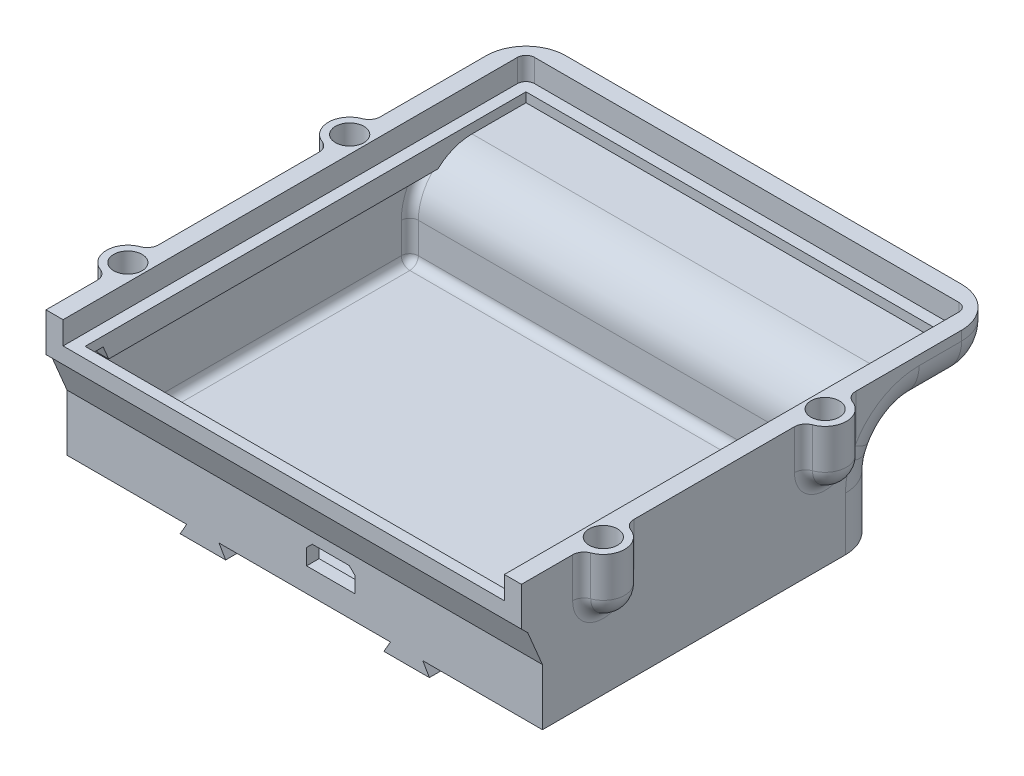
from build123d import *

# Parameters (mm, degrees)
SKETCH1_W            = 132
SKETCH1_H            = 85.5
SKETCH1_W_2          = 126
SKETCH1_H_2          = 79.5
BOSS_EXTRUDE1_DEPTH  = 21
SKETCH2_W            = 132
SKETCH2_H            = 85.5
BOSS_EXTRUDE2_DEPTH  = 3
SKETCH3_W            = 126
SKETCH3_H            = 3
CUT_EXTRUDE1_DEPTH   = 4
BOSS_EXTRUDE3_DEPTH  = 4
SKETCH6_W            = 12
SKETCH6_H            = 7.5
CUT_EXTRUDE2_DEPTH   = 3
BOSS_EXTRUDE4_DEPTH  = 85.5
SKETCH10_R           = 2.5
CUT_EXTRUDE3_DEPTH   = 7
SKETCH11_R           = 3.75
SKETCH11_R_2         = 2.5
BOSS_EXTRUDE5_DEPTH  = 7
REVOLVE2_ANGLE       = 90
SKETCH14_W           = 126
SKETCH14_H           = 82.5
CUT_EXTRUDE4_DEPTH   = 4
CUT_EXTRUDE5_REACH   = 88.597
SKETCH17_W           = 54.009013967
SKETCH17_H           = 11.661309321
REVOLVE3_ANGLE       = 90
FILLET1_R            = 2
SKETCH20_W           = 12
SKETCH20_H           = 7.5
BOSS_EXTRUDE8_DEPTH  = 2
SKETCH21_W           = 12
SKETCH21_H           = 7.5
CUT_EXTRUDE6_DEPTH   = 2
SKETCH22_W           = 66.226756427
SKETCH22_H           = 42.382951543
CUT_EXTRUDE7_DEPTH   = 90
SKETCH23_W           = 42.542497138
SKETCH23_H           = 32.518915608
CUT_EXTRUDE8_DEPTH   = 90
BOSS_EXTRUDE11_REACH = 69.779
SKETCH28_W           = 3
SKETCH28_H           = 7.5
SKETCH24_W           = 77.790944938
SKETCH24_H           = 2.5
BOSS_EXTRUDE9_DEPTH  = 4
SKETCH26_W           = 73.6
SKETCH26_H           = 4
BOSS_EXTRUDE10_DEPTH = 1
SKETCH27_W           = 8.505375435
SKETCH27_H           = 3.8
CUT_EXTRUDE9_DEPTH   = 3
CHAMFER1_SIZE        = 1
SKETCH31_W           = 77.6
SKETCH31_H           = 13
BOSS_EXTRUDE13_DEPTH = 6
CUT_EXTRUDE10_DEPTH  = 6.8
CHAMFER3_SIZE        = 4
SKETCH32_W           = 77.6
SKETCH32_H           = 75.5
CUT_EXTRUDE11_DEPTH  = 0.5
CUT_EXTRUDE12_REACH  = 102.145
SKETCH33_W           = 3.1
SKETCH33_H           = 11.91996344
CUT_EXTRUDE13_REACH  = 102.145
BOSS_EXTRUDE15_DEPTH = 83.6
FILLET2_R            = 7
BOSS_EXTRUDE16_DEPTH = 3
FILLET5_R            = 7
CUT_EXTRUDE14_START  = -87.35
CUT_EXTRUDE14_DEPTH  = 91.1
SKETCH39_W           = 83.6
SKETCH39_H           = 5.232590181
BOSS_EXTRUDE17_DEPTH = 2
SKETCH40_W           = 77.6
SKETCH40_H           = 1.874834467
BOSS_EXTRUDE18_DEPTH = 2.5
CUT_EXTRUDE15_REACH  = 99.54
FILLET3_R            = 1.5
BOSS_EXTRUDE28_DEPTH = 1.5
BOSS_EXTRUDE29_DEPTH = 83.6


with BuildPart() as part:
    # Sketch1 → Boss-Extrude1 (new body)
    with BuildSketch(Plane(origin=(0, 0, 0), x_dir=(1, 0, 0), z_dir=(0, 1, 0))):
        with Locations((0, 1.5)):
            Rectangle(SKETCH1_W, SKETCH1_H)
        with Locations((0, 1.5)):
            Rectangle(SKETCH1_W_2, SKETCH1_H_2, mode=Mode.SUBTRACT)
    extrude(amount=BOSS_EXTRUDE1_DEPTH)

    # Sketch2 → Boss-Extrude2 (add)
    with BuildSketch(Plane.XZ):
        with Locations((0, -1.5)):
            Rectangle(SKETCH2_W, SKETCH2_H)
    extrude(amount=BOSS_EXTRUDE2_DEPTH)

    # Sketch3 → Cut-Extrude1 (cut)
    with BuildSketch(Plane(origin=(0, 21, 0), x_dir=(1, 0, 0), z_dir=(0, 1, 0))):
        with Locations((0, -39.75)):
            Rectangle(SKETCH3_W, SKETCH3_H)
    extrude(amount=-CUT_EXTRUDE1_DEPTH, mode=Mode.SUBTRACT)

    # Sketch4 → Boss-Extrude3 (add)
    with BuildSketch(Plane(origin=(0, 17, 0), x_dir=(1, 0, 0), z_dir=(0, 1, 0))):
        Polygon((-61, 39.25), (-61, -38.25), (-63, -38.25), (-63, 41.25), (63, 41.25), (63, -38.25), (61, -38.25), (61, 39.25), align=None)
    extrude(amount=-BOSS_EXTRUDE3_DEPTH)

    # Sketch6 → Cut-Extrude2 (cut)
    with BuildSketch(Plane.XY.offset(41.25)):
        with Locations((-19.5, 7.5)):
            Rectangle(SKETCH6_W, SKETCH6_H)
        with Locations((32.5, 7.5)):
            Rectangle(SKETCH6_W, SKETCH6_H)
    extrude(amount=-CUT_EXTRUDE2_DEPTH, mode=Mode.SUBTRACT)

    # Sketch7 → Boss-Extrude4 (add)
    with BuildSketch(Plane.XY.offset(41.25)):
        Polygon((-46.113248654, -5), (-38.113248654, -5), (-39.267949192, -3), (-44.958548116, -3), align=None)
        Polygon((39.267949192, -3), (44.958548116, -3), (46.113248654, -5), (38.113248654, -5), align=None)
    extrude(amount=-BOSS_EXTRUDE4_DEPTH)

    # Sketch10 → Cut-Extrude3 (cut)
    with BuildSketch(Plane(origin=(0, 21, 0), x_dir=(1, 0, 0), z_dir=(0, 1, 0))):
        with Locations((-66, 13.25)):
            Circle(SKETCH10_R)
        with Locations((-66, -25.75)):
            Circle(SKETCH10_R)
        with Locations((66, -25.75)):
            Circle(SKETCH10_R)
    extrude(amount=-CUT_EXTRUDE3_DEPTH, mode=Mode.SUBTRACT)

    # Sketch11 → Boss-Extrude5 (add)
    # profile 1 of 3: a face of its own
    with BuildSketch(Plane(origin=(0, 21, 0), x_dir=(1, 0, 0), z_dir=(0, 1, 0))):
        with Locations((-66, 13.25)):
            Circle(SKETCH11_R)
        with Locations(Location((-66, 13.25, 0), (0, 0, 270))):
            Circle(SKETCH11_R_2, mode=Mode.SUBTRACT)
    # profile 2 of 3: a face of its own
    with BuildSketch(Plane(origin=(0, 21, 0), x_dir=(1, 0, 0), z_dir=(0, 1, 0))):
        with Locations((-66, -25.75)):
            Circle(SKETCH11_R)
        with Locations(Location((-66, -25.75, 0), (0, 0, 90))):
            Circle(SKETCH11_R_2, mode=Mode.SUBTRACT)
    # profile 3 of 3: a face of its own
    with BuildSketch(Plane(origin=(0, 21, 0), x_dir=(1, 0, 0), z_dir=(0, 1, 0))):
        with Locations((66, -25.75)):
            Circle(SKETCH11_R)
        with Locations(Location((66, -25.75, 0), (0, 0, 270))):
            Circle(SKETCH11_R_2, mode=Mode.SUBTRACT)
    extrude(amount=-BOSS_EXTRUDE5_DEPTH)

    # Sketch13 → Revolve2 (revolve)
    with BuildSketch(Plane.XZ.offset(-14)):
        with BuildLine():
            Line((-66, -17), (-66, -10.75))
            Line((-66, -10.75), (-66, -9.5))
            ThreePointArc((-66, -9.5), (-69.75, -13.25), (-66, -17))
        make_face()
        with BuildLine():
            Line((-66, 22), (-66, 28.25))
            Line((-66, 28.25), (-66, 29.5))
            ThreePointArc((-66, 29.5), (-69.75, 25.75), (-66, 22))
        make_face()
    revolve(axis=Axis((-66, 14, 22), (0, 0, 1)), revolution_arc=REVOLVE2_ANGLE)

    # Sketch14 → Cut-Extrude4 (cut)
    with BuildSketch(Plane(origin=(0, 21, 0), x_dir=(1, 0, 0), z_dir=(0, 1, 0))):
        Rectangle(SKETCH14_W, SKETCH14_H)
    extrude(amount=-CUT_EXTRUDE4_DEPTH, mode=Mode.SUBTRACT)

    # Cut-Extrude5: up to this face of the body (flat: up to its plane)
    cut_extrude5_end = Plane(part.part.faces().sort_by_distance((42.113248654, -5, -1.5))[0])
    # Sketch17 → Cut-Extrude5 (cut, up to the picked face)
    with BuildSketch(Plane(origin=(0, 21, 0), x_dir=(1, 0, 0), z_dir=(0, 1, 0)), mode=Mode.PRIVATE) as cut_extrude5_sk1:
        with Locations((41.004506984, 40.580654661)):
            Rectangle(SKETCH17_W, SKETCH17_H)
    cut_extrude5_tool1 = split(extrude(cut_extrude5_sk1.sketch, amount=-CUT_EXTRUDE5_REACH, mode=Mode.PRIVATE), bisect_by=cut_extrude5_end, keep=Keep.BOTH, mode=Mode.PRIVATE)
    add(cut_extrude5_tool1.solids().sort_by(Axis((41.004507, 21, -40.580655), (0, -1, 0)))[0], mode=Mode.SUBTRACT)

    # Sketch19 → Revolve3 (revolve)
    with BuildSketch(Plane.XZ.offset(-14)):
        with BuildLine():
            Line((66, 28.25), (66, 22))
            ThreePointArc((66, 22), (69.75, 25.75), (66, 29.5))
            Line((66, 29.5), (66, 28.25))
        make_face()
    revolve(axis=Axis((66, 14, 28.25), (0, 0, -1)), revolution_arc=REVOLVE3_ANGLE)

    # Fillet1
    fillet1_edges = [part.edges().sort_by_distance(p)[0] for p in [
        (-66, 17.5, -17),
        (-66, 17.5, -9.5),
        (-66, 17.5, 22),
        (-66, 17.5, 29.5),
        (66, 17.5, 29.5),
        (66, 17.5, 22),
        (-66, 10.25, 25.75),
        (-66, 10.25, -13.25),
        (66, 10.25, 25.75),
    ]]
    fillet(fillet1_edges, radius=FILLET1_R)

    # Sketch20 → Boss-Extrude8 (add)
    with BuildSketch(Plane.XY.offset(41.25)):
        Polygon((66, 21), (63, 21), (63, 17), (-63, 17), (-63, 21), (-66, 21), (-66, -3), (-44.958548116, -3), (-46.113248654, -5), (-38.113248654, -5), (-39.267949192, -3), (39.267949192, -3), (38.113248654, -5), (46.113248654, -5), (44.958548116, -3), (66, -3), align=None)
        with Locations((-19.5, 7.5)):
            Rectangle(SKETCH20_W, SKETCH20_H, mode=Mode.SUBTRACT)
        with Locations((32.5, 7.5)):
            Rectangle(SKETCH20_W, SKETCH20_H, mode=Mode.SUBTRACT)
    extrude(amount=BOSS_EXTRUDE8_DEPTH)

    # Sketch21 → Cut-Extrude6 (cut)
    with BuildSketch(Plane(origin=(0, 0, 38.25), x_dir=(-1, 0, 0), z_dir=(0, 0, -1))):
        Polygon((61, 13), (61, 17), (-61, 17), (-61, 13), (-63, 13), (-63, 0), (63, 0), (63, 13), align=None)
        with Locations((-32.5, 7.5)):
            Rectangle(SKETCH21_W, SKETCH21_H, mode=Mode.SUBTRACT)
        with Locations((19.5, 7.5)):
            Rectangle(SKETCH21_W, SKETCH21_H, mode=Mode.SUBTRACT)
    extrude(amount=-CUT_EXTRUDE6_DEPTH, mode=Mode.SUBTRACT)

    # Sketch22 → Cut-Extrude7 (cut)
    with BuildSketch(Plane(origin=(0, 0, -34.75), x_dir=(-1, 0, 0), z_dir=(0, 0, -1))):
        with Locations((-47.113378213, 8.416458625)):
            Rectangle(SKETCH22_W, SKETCH22_H)
    extrude(amount=-CUT_EXTRUDE7_DEPTH, mode=Mode.SUBTRACT)

    # Sketch23 → Cut-Extrude8 (cut)
    with BuildSketch(Plane.XY.offset(43.25)):
        with Locations((-2.928751431, 9.569248977)):
            Rectangle(SKETCH23_W, SKETCH23_H)
    extrude(amount=-CUT_EXTRUDE8_DEPTH, mode=Mode.SUBTRACT)

    # Mirror1: part across plane


with BuildPart() as part_1:
    add(part.part)
    add(part.part.mirror(Plane(origin=(-24.2, 25.828706781, -46.75), x_dir=(0, 0, 1), z_dir=(-1, 0, 0))))

    # Sketch28 → Boss-Extrude11 (add, up to next)
    with BuildSketch(Plane(origin=(-25.5, 0, 0), x_dir=(0, 0, -1), z_dir=(1, 0, 0)), mode=Mode.PRIVATE) as boss_extrude11_sk1:
        with Locations((-41.75, 7.5)):
            Rectangle(SKETCH28_W, SKETCH28_H)
    boss_extrude11_tool1 = extrude(boss_extrude11_sk1.sketch, amount=BOSS_EXTRUDE11_REACH, mode=Mode.PRIVATE) - part_1.part
    add(boss_extrude11_tool1.solids().sort_by_distance((-25.5, 7.5, 41.75))[0])

    # Sketch24 → Boss-Extrude9 (add)
    with BuildSketch(Plane(origin=(0, 17, 0), x_dir=(1, 0, 0), z_dir=(0, 1, 0))):
        with Locations((-24.295472469, -42)):
            Rectangle(SKETCH24_W, SKETCH24_H)
    extrude(amount=BOSS_EXTRUDE9_DEPTH)

    # Sketch26 → Boss-Extrude10 (add)
    with BuildSketch(Plane(origin=(0, 0, 40.25), x_dir=(-1, 0, 0), z_dir=(0, 0, -1))):
        with Locations((24.2, 15)):
            Rectangle(SKETCH26_W, SKETCH26_H)
    extrude(amount=BOSS_EXTRUDE10_DEPTH)

    # Sketch27 → Cut-Extrude9 (cut)
    with BuildSketch(Plane.XY.offset(43.25)):
        with Locations((-19.62505423, 3.12)):
            Rectangle(SKETCH27_W, SKETCH27_H)
    extrude(amount=-CUT_EXTRUDE9_DEPTH, mode=Mode.SUBTRACT)

    # Chamfer1
    chamfer1_edges = [part_1.edges().sort_by_distance(p)[0] for p in [
        (-23.877741947, 5.02, 41.75),
        (-15.372366512, 5.02, 41.75),
    ]]
    chamfer(chamfer1_edges, length=CHAMFER1_SIZE)

    # Sketch31 → Boss-Extrude13 (add)
    with BuildSketch(Plane(origin=(0, 0, 40.25), x_dir=(-1, 0, 0), z_dir=(0, 0, -1))):
        with Locations((24.2, 6.5)):
            Rectangle(SKETCH31_W, SKETCH31_H)
        Polygon((15.372366512, 1.22), (15.372366512, 4.02), (16.372366512, 5.02), (22.877741947, 5.02), (23.877741947, 4.02), (23.877741947, 1.22), align=None, mode=Mode.SUBTRACT)
    extrude(amount=BOSS_EXTRUDE13_DEPTH)

    # Sketch29 → Cut-Extrude10 (cut)
    with BuildSketch(Plane.XY.offset(43.25)):
        Polygon((-66, 10), (17.6, 10), (17.6, -3), (-3.441451884, -3), (-2.286751346, -5), (-10.286751346, -5), (-9.132050808, -3), (-39.267949192, -3), (-38.113248654, -5), (-46.113248654, -5), (-44.958548116, -3), (-66, -3), align=None)
    extrude(amount=-CUT_EXTRUDE10_DEPTH, mode=Mode.SUBTRACT)

    # Chamfer3
    chamfer3_edges = [part_1.edges().sort_by_distance(p)[0] for p in [
        (-24.2, 10, 36.45),
    ]]
    chamfer(chamfer3_edges, length=CHAMFER3_SIZE)

    # Sketch32 → Cut-Extrude11 (cut)
    with BuildSketch(Plane(origin=(0, 0, 0), x_dir=(1, 0, 0), z_dir=(0, 1, 0))):
        with Locations((-24.2, 3.5)):
            Rectangle(SKETCH32_W, SKETCH32_H)
    extrude(amount=-CUT_EXTRUDE11_DEPTH, mode=Mode.SUBTRACT)

    # Cut-Extrude12: up to this face of the body (flat: up to its plane)
    cut_extrude12_end = Plane(part_1.part.faces().sort_by_distance((17.6, 8.41084829, -3.254582119))[0])
    # Sketch33 → Cut-Extrude12 (cut, up to the picked face)
    with BuildSketch(Plane.ZY.offset(66), mode=Mode.PRIVATE) as cut_extrude12_sk1:
        with Locations((41.7, 15.04001828)):
            Rectangle(SKETCH33_W, SKETCH33_H)
    cut_extrude12_tool1 = split(extrude(cut_extrude12_sk1.sketch, amount=-CUT_EXTRUDE12_REACH, mode=Mode.PRIVATE), bisect_by=cut_extrude12_end, keep=Keep.BOTH, mode=Mode.PRIVATE)
    add(cut_extrude12_tool1.solids().sort_by(Axis((-66, 15.040018, 41.7), (1, 0, 0)))[0], mode=Mode.SUBTRACT)

    # Cut-Extrude13: up to this face of the body (flat: up to its plane)
    cut_extrude13_end = Plane(part_1.part.faces().sort_by_distance((17.6, 8.272134242, -4.135091615))[0])
    # Sketch35 → Cut-Extrude13 (cut, up to the picked face)
    with BuildSketch(Plane.ZY.offset(66), mode=Mode.PRIVATE) as cut_extrude13_sk1:
        with BuildLine():
            Line((-44.25, 15.33328953), (-29.765015722, 15.33328953))
            ThreePointArc((-29.765015722, 15.33328953), (-23.445451102, 12.715640156), (-20.827801728, 6.396075535))
            Line((-20.827801728, 6.396075535), (-20.827801728, -5))
            Line((-20.827801728, -5), (-44.25, -5))
            Line((-44.25, -5), (-44.25, 15.33328953))
        make_face()
    cut_extrude13_tool1 = split(extrude(cut_extrude13_sk1.sketch, amount=-CUT_EXTRUDE13_REACH, mode=Mode.PRIVATE), bisect_by=cut_extrude13_end, keep=Keep.BOTH, mode=Mode.PRIVATE)
    add(cut_extrude13_tool1.solids().sort_by(Axis((-66, 4.861601, -32.901608), (1, 0, 0)))[0], mode=Mode.SUBTRACT)

    # Sketch36 → Boss-Extrude15 (add)
    with BuildSketch(Plane.ZY.offset(66)):
        with BuildLine():
            Line((-44.25, 15.33328953), (-29.765015722, 15.33328953))
            ThreePointArc((-29.765015722, 15.33328953), (-23.445451102, 12.715640156), (-20.827801728, 6.396075535))
            Line((-20.827801728, 6.396075535), (-20.827801728, -3))
            Line((-20.827801728, -3), (-23.827801728, -3))
            Line((-23.827801728, -3), (-23.827801728, 6.396075535))
            ThreePointArc((-23.827801728, 6.396075535), (-25.566771445, 10.594319812), (-29.765015722, 12.33328953))
            Line((-29.765015722, 12.33328953), (-44.25, 12.33328953))
            Line((-44.25, 12.33328953), (-44.25, 15.33328953))
        make_face()
    extrude(amount=-BOSS_EXTRUDE15_DEPTH)

    # Fillet2
    fillet2_edges = [part_1.edges().sort_by_distance(p)[0] for p in [
        (17.6, 16.666644765, -44.25),
        (-66, 16.666644765, -44.25),
        (-66, 12.33328953, -37.007507861),
        (-66, 10.594319812, -25.566771445),
        (-66, 1.698037768, -23.827801728),
        (17.6, 1.698037768, -23.827801728),
        (17.6, 10.594319812, -25.566771445),
        (17.6, 12.33328953, -37.007507861),
    ]]
    fillet(fillet2_edges, radius=FILLET2_R)

    # Sketch37 → Boss-Extrude16 (add)
    with BuildSketch(Plane(origin=(0, 0, -20.827801728), x_dir=(-1, 0, 0), z_dir=(0, 0, -1))):
        Polygon((46.113248654, -5), (44.958548116, -3), (39.267949192, -3), (38.113248654, -5), align=None)
        Polygon((10.286751346, -5), (9.132050808, -3), (3.441451884, -3), (2.286751346, -5), align=None)
    extrude(amount=BOSS_EXTRUDE16_DEPTH)

    # Fillet5
    # the kernel refuses this fillet: 7 mm, written as the material it takes off along each edge
    with BuildSketch(Plane(origin=(10.6, 19.33328953, -37.25), x_dir=(0, 0, -1), z_dir=(0, -1, 0))) as fillet5_piece_1_section:
        Polygon((0, 0), (FILLET5_R, 0), (FILLET5_R, FILLET5_R), (0, FILLET5_R), align=None)
    fillet5_piece_1 = extrude(amount=FILLET5_R, mode=Mode.PRIVATE)
    fillet5_piece_1 = fillet5_piece_1 - Plane(origin=(10.6, 19.33328953, -37.25), x_dir=(-0.7071067811865475, 0, 0.7071067811865475), z_dir=(0, -1, 0)) * Sphere(FILLET5_R, mode=Mode.PRIVATE)
    add(fillet5_piece_1, mode=Mode.SUBTRACT)
    with BuildSketch(Plane(origin=(-59, 19.33328953, -37.25), x_dir=(0, 0, -1), z_dir=(0, -1, 0))) as fillet5_piece_2_section:
        Polygon((0, 0), (FILLET5_R, 0), (FILLET5_R, -FILLET5_R), (0, -FILLET5_R), align=None)
    fillet5_piece_2 = extrude(amount=FILLET5_R, mode=Mode.PRIVATE)
    fillet5_piece_2 = fillet5_piece_2 - Plane(origin=(-59, 19.33328953, -37.25), x_dir=(0.7071067811865475, 0, 0.7071067811865475), z_dir=(0, -1, 0)) * Sphere(FILLET5_R, mode=Mode.PRIVATE)
    add(fillet5_piece_2, mode=Mode.SUBTRACT)
    with BuildSketch(Plane(origin=(-59, 12.33328953, -44.25), x_dir=(0, 0, 1), z_dir=(1, 0, 0))) as fillet5_piece_3:
        with BuildLine():
            CenterArc((FILLET5_R, -FILLET5_R), FILLET5_R, 90, 90)
            Line((0, -FILLET5_R), (0, 0))
            Line((0, 0), (FILLET5_R, 0))
        make_face()
    extrude(amount=69.6, mode=Mode.SUBTRACT)

    # Sketch38 → Cut-Extrude14 (cut)
    with BuildSketch(Plane(origin=(17.6, 0, 0), x_dir=(0, 0, -1), z_dir=(1, 0, 0)).offset(CUT_EXTRUDE14_START)):
        Polygon((-40.15, 14.18), (-36.45, 10.48), (-36.45, 6), (-40.15, 9.7), align=None)
    extrude(amount=CUT_EXTRUDE14_DEPTH, mode=Mode.SUBTRACT)

    # Sketch39 → Boss-Extrude17 (add)
    with BuildSketch(Plane(origin=(0, -12.985, 12.985), x_dir=(1, 0, 0), z_dir=(0, -0.707106781186554, 0.7071067811865411))):
        with Locations((-24.2, 35.800816332)):
            Rectangle(SKETCH39_W, SKETCH39_H)
    extrude(amount=-BOSS_EXTRUDE17_DEPTH)

    # Sketch40 → Boss-Extrude18 (add)
    with BuildSketch(Plane(origin=(0, 17, 0), x_dir=(1, 0, 0), z_dir=(0, 1, 0))):
        with Locations((-24.2, -39.212582767)):
            Rectangle(SKETCH40_W, SKETCH40_H)
    extrude(amount=-BOSS_EXTRUDE18_DEPTH)

    # Cut-Extrude15: up to this face of the body (flat: up to its plane)
    cut_extrude15_end = Plane(part_1.part.faces().sort_by_distance((-63, 6.290812259, 6.486515551))[0])
    # Sketch41 → Cut-Extrude15 (cut, up to the picked face)
    with BuildSketch(Plane.ZY.offset(-14.6), mode=Mode.PRIVATE) as cut_extrude15_sk1:
        Polygon((38.356762721, 15.327513103), (34.25, 5.567553607), (31.484820982, 6.731076275), (35.102000574, 15.327513103), align=None)
    cut_extrude15_tool1 = split(extrude(cut_extrude15_sk1.sketch, amount=CUT_EXTRUDE15_REACH, mode=Mode.PRIVATE), bisect_by=cut_extrude15_end, keep=Keep.BOTH, mode=Mode.PRIVATE)
    add(cut_extrude15_tool1.solids().sort_by(Axis((14.6, 10.732268, 34.830194), (-1, 0, 0)))[0], mode=Mode.SUBTRACT)

    # Fillet3
    fillet3_edges = [part_1.edges().sort_by_distance(p)[0] for p in [
        (14.6, 2.533776803, 34.25),
        (-63, 19, -41.25),
        (14.6, 19, -41.25),
        (-63, 2.533776803, 34.25),
        (14.6, -0.5, 6.711099136),
        (-24.2, -0.5, 34.25),
        (-63, -0.5, 6.711099136),
        (-24.2, -0.5, -20.827801728),
        (14.6, 10.005490492, -21.589080445),
        (-63, 10.005490492, -21.589080445),
        (-63, 2.948037768, -20.827801728),
        (14.6, 2.948037768, -20.827801728),
    ]]
    fillet(fillet3_edges, radius=FILLET3_R)

    # Sketch45 → Boss-Extrude28 (add)
    with BuildSketch(Plane(origin=(0, -11.40632383, 27.107789304), x_dir=(-1, 0, 0), z_dir=(0, 0.3878408892465759, -0.9217263393374551))):
        with BuildLine():
            Line((63, 29.004093506), (-14.6, 29.004093506))
            Line((-14.6, 29.004093506), (-14.6, 14.547745872))
            add(Edge.make_bspline(
                [(-13.1, 18.415311262), (-14.6, 18.415311262), (-14.6, 14.547745872)],
                knots=[0, 0, 0, 1.570796327, 1.570796327, 1.570796327], degree=2, weights=[1, 0.707106781, 1]))
            Line((-13.1, 18.415311262), (61.5, 18.415311262))
            add(Edge.make_bspline(
                [(63, 14.547745872), (63, 18.415311262), (61.5, 18.415311262)],
                knots=[1.570796327, 1.570796327, 1.570796327, 3.141592654, 3.141592654, 3.141592654], degree=2, weights=[1, 0.707106781, 1]))
            Line((63, 14.547745872), (63, 29.004093506))
        make_face()
    extrude(amount=-BOSS_EXTRUDE28_DEPTH)

    # Sketch46 → Boss-Extrude29 (add)
    with BuildSketch(Plane(origin=(17.6, 0, 0), x_dir=(0, 0, -1), z_dir=(1, 0, 0))):
        Polygon((-36.45, 10.48), (-39.030047144, 13.060047144), (-36.45, 6.928415654), align=None)
    extrude(amount=-BOSS_EXTRUDE29_DEPTH)


solid = part_1.part
